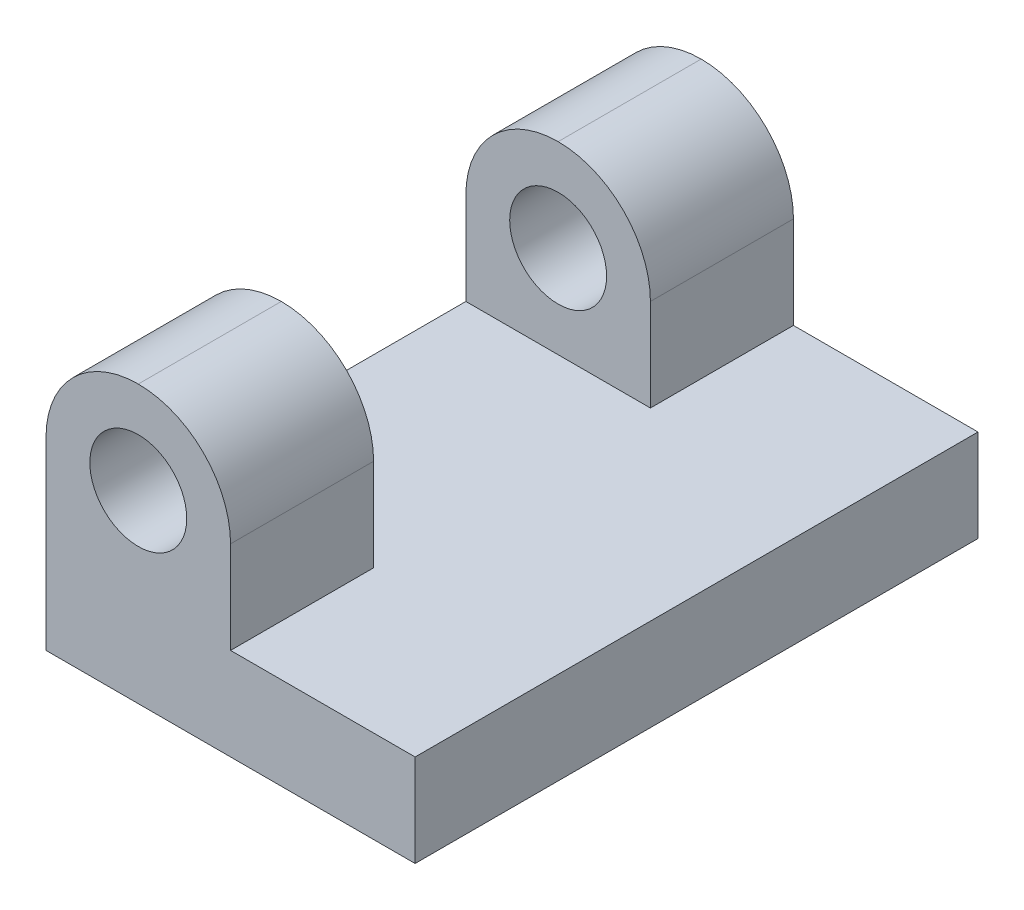
from build123d import *

# Parameters (mm, degrees)
SKETCH1_W           = 12
SKETCH1_H           = 18.3
BOSS_EXTRUDE1_DEPTH = 3
SKETCH2_W           = 6
SKETCH2_H           = 18.3
BOSS_EXTRUDE2_DEPTH = 6
SKETCH3_R           = 1.575
CUT_EXTRUDE1_DEPTH  = 22.257704486
SKETCH4_W           = 6
SKETCH4_H           = 9
CUT_EXTRUDE2_DEPTH  = 6
FILLET1_R           = 3


with BuildPart() as part:
    # Sketch1 → Boss-Extrude1 (new body)
    with BuildSketch(Plane(origin=(0, 0, 0), x_dir=(1, 0, 0), z_dir=(0, 1, 0))):
        Rectangle(SKETCH1_W, SKETCH1_H)
    extrude(amount=BOSS_EXTRUDE1_DEPTH)

    # Sketch2 → Boss-Extrude2 (add)
    with BuildSketch(Plane(origin=(0, 3, 0), x_dir=(1, 0, 0), z_dir=(0, 1, 0))):
        with Locations((-3, 0)):
            Rectangle(SKETCH2_W, SKETCH2_H)
    extrude(amount=BOSS_EXTRUDE2_DEPTH)

    # Sketch3 → Cut-Extrude1 (cut, through all)
    with BuildSketch(Plane.XY.offset(9.15)):
        with Locations((-3, 6)):
            Circle(SKETCH3_R)
    extrude(amount=-CUT_EXTRUDE1_DEPTH, mode=Mode.SUBTRACT)

    # Sketch4 → Cut-Extrude2 (cut)
    with BuildSketch(Plane(origin=(0, 9, 0), x_dir=(1, 0, 0), z_dir=(0, 1, 0))):
        with Locations((-3, 0)):
            Rectangle(SKETCH4_W, SKETCH4_H)
    extrude(amount=-CUT_EXTRUDE2_DEPTH, mode=Mode.SUBTRACT)

    # Fillet1
    fillet1_edges = [part.edges().sort_by_distance(p)[0] for p in [
        (-6, 9, 6.825),
        (0, 9, 6.825),
        (-6, 9, -6.825),
        (0, 9, -6.825),
    ]]
    fillet(fillet1_edges, radius=FILLET1_R - 0.0001)  # a hair under: the kernel refuses the full size


solid = part.part
